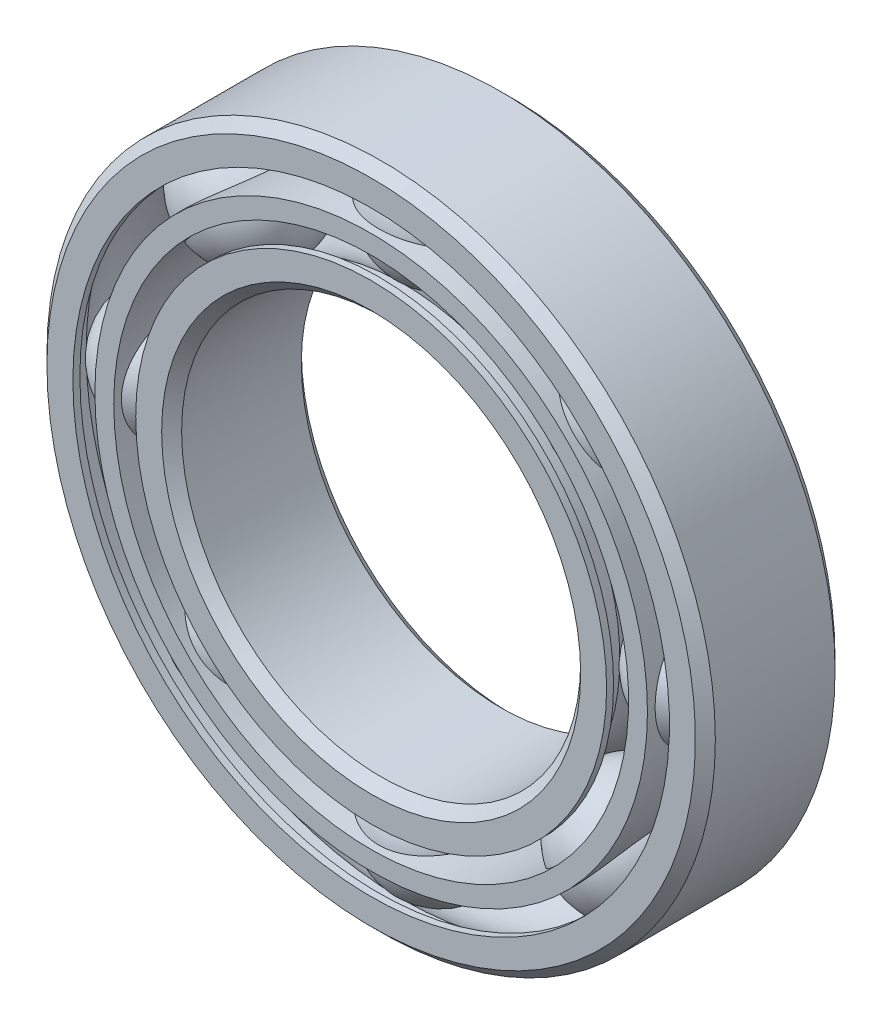
from build123d import *

# Parameters (mm, degrees)
SKETCH6_W         = 1.889999999999997
SKETCH6_H         = 14.000000000000002
CIRPATTERN1_COUNT = 8
CIRPATTERN2_COUNT = 8
CHAMFER2_SIZE     = 1
CHAMFER3_SIZE     = 1


with BuildPart() as part:
    # Sketch6 → Revolve1 (revolve)
    with BuildSketch(Plane(origin=(0, 0, 0), x_dir=(1, 0, 0), z_dir=(0, 1, 0))):
        with BuildLine():
            Line((20, 0), (20, -14))
            Line((20, -14), (23.6, -14))
            Line((23.6, -14), (23.6, -13.299999999999999))
            Line((23.6, -13.299999999999999), (21.71, -13.299999999999999))
            Line((21.71, -13.299999999999999), (21.71, -10.779999999999996))
            ThreePointArc((21.71, -10.779999999999996), (20.450000000000003, -6.999999999999999), (21.71, -3.220000000000004))
            Line((21.71, -3.220000000000004), (21.71, -0.7000000000000001))
            Line((21.71, -0.7000000000000001), (23.6, -0.7000000000000001))
            Line((23.6, -0.7000000000000001), (23.6, 0))
            Line((23.6, 0), (20, 0))
        make_face()
        with BuildLine():
            Line((29.900000000000002, 0), (29.900000000000002, -0.7000000000000001))
            Line((29.900000000000002, -0.7000000000000001), (31.79, -0.7000000000000001))
            Line((31.79, -0.7000000000000001), (31.79, -3.219999999999999))
            ThreePointArc((31.79, -3.219999999999999), (33.05, -7), (31.79, -10.780000000000001))
            Line((31.79, -10.780000000000001), (31.79, -13.299999999999999))
            Line((31.79, -13.299999999999999), (29.900000000000002, -13.299999999999999))
            Line((29.900000000000002, -13.299999999999999), (29.900000000000002, -14))
            Line((29.900000000000002, -14), (33.5, -14.000000000000002))
            Line((33.5, -14.000000000000002), (33.5, -1.73e-15))
            Line((33.5, -1.73e-15), (29.900000000000002, 0))
        make_face()
        with Locations((26.75, -7.000000000000001)):
            Rectangle(SKETCH6_W, SKETCH6_H)
    revolve(axis=Axis((0, 0, -14.547408252782462), (0, 0, 1)))

    # Sketch7 → Cut-Revolve1 (revolve, cut)
    with BuildSketch(Plane(origin=(0, 0, 0), x_dir=(1, 0, 0), z_dir=(0, 1, 0))):
        with BuildLine():
            ThreePointArc((26.750000000000004, -13.299999999999997), (33.050000000000004, -6.999999999999998), (26.750000000000004, -0.7000000000000002))
            Line((26.750000000000004, -0.7000000000000001), (26.750000000000004, -13.299999999999999))
        make_face()
    cut_revolve1 = revolve(axis=Axis((26.750000000000004, 0, -1.2848014115493884), (0, 0, 1)), mode=Mode.SUBTRACT)

    # CirPattern1: Cut-Revolve1 ×8 about axis
    cirpattern1_axis = Axis((0, 0, 1.73e-15), (0, 0, -1))
    for i in range(1, CIRPATTERN1_COUNT):
        add(cut_revolve1.rotate(cirpattern1_axis, i * 360 / CIRPATTERN1_COUNT), mode=Mode.SUBTRACT)


with BuildPart() as body_2:
    # Sketch7<3> → Revolve2 (revolve)
    with BuildSketch(Plane(origin=(0, 0, 0), x_dir=(1, 0, 0), z_dir=(0, 1, 0))):
        with BuildLine():
            Line((26.750000000000004, -0.7000000000000001), (26.750000000000004, -13.299999999999999))
            ThreePointArc((26.750000000000004, -13.299999999999999), (33.050000000000004, -7), (26.750000000000004, -0.7000000000000001))
        make_face()
    revolve2 = revolve(axis=Axis((26.750000000000004, 0, -1.2848014115493884), (0, 0, 1)))


with BuildPart() as part_1:
    add(part.part)

    # CirPattern2: Revolve2 ×8 about axis
    cirpattern2_axis = Axis((0, 0, 1.73e-15), (0, 0, -1))
    for i in range(1, CIRPATTERN2_COUNT):
        add(revolve2.rotate(cirpattern2_axis, i * 360 / CIRPATTERN2_COUNT))

    # Chamfer2
    chamfer2_edges = [part_1.edges().sort_by_distance(p)[0] for p in [
        (-33.5, 4.1e-15, 14.000000000000002),
        (-33.5, 4.1e-15, 1.78e-15),
    ]]
    chamfer(chamfer2_edges, length=CHAMFER2_SIZE)

    # Chamfer3
    chamfer3_edges = [part_1.edges().sort_by_distance(p)[0] for p in [
        (-20, 2.45e-15, 0),
        (-20, 2.45e-15, 13.999999999999998),
    ]]
    chamfer(chamfer3_edges, length=CHAMFER3_SIZE)


solid = Compound([body_2.part, part_1.part])
